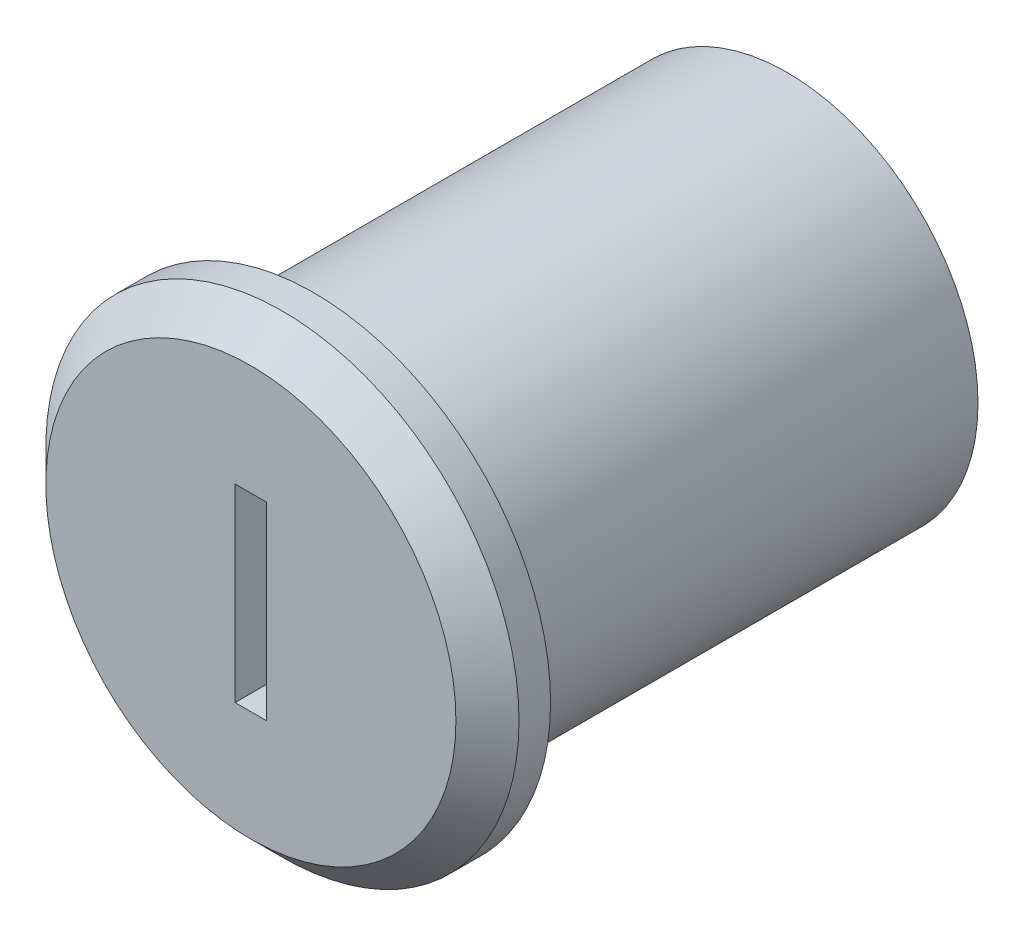
from build123d import *

# Parameters (mm, degrees)
SKETCH1_R           = 6.05
BOSS_EXTRUDE1_DEPTH = 15
SKETCH2_R           = 7.5
BOSS_EXTRUDE2_DEPTH = 1
SKETCH3_R           = 7.5
BOSS_EXTRUDE3_DEPTH = 1
BOSS_EXTRUDE3_TAPER = 45
SKETCH4_W           = 1
SKETCH4_H           = 6
CUT_EXTRUDE1_DEPTH  = 1


with BuildPart() as part:
    # Sketch1 → Boss-Extrude1 (new body)
    with BuildSketch(Plane.XY):
        Circle(SKETCH1_R)
    extrude(amount=-BOSS_EXTRUDE1_DEPTH)

    # Sketch2 → Boss-Extrude2 (add)
    with BuildSketch(Plane.XY):
        Circle(SKETCH2_R)
    extrude(amount=BOSS_EXTRUDE2_DEPTH)

    # Sketch3 → Boss-Extrude3 (add)
    with BuildSketch(Plane.XY.offset(1)):
        Circle(SKETCH3_R)
    extrude(amount=BOSS_EXTRUDE3_DEPTH, taper=BOSS_EXTRUDE3_TAPER)

    # Sketch4 → Cut-Extrude1 (cut)
    with BuildSketch(Plane.XY.offset(2)):
        Rectangle(SKETCH4_W, SKETCH4_H)
    extrude(amount=-CUT_EXTRUDE1_DEPTH, mode=Mode.SUBTRACT)


solid = part.part
